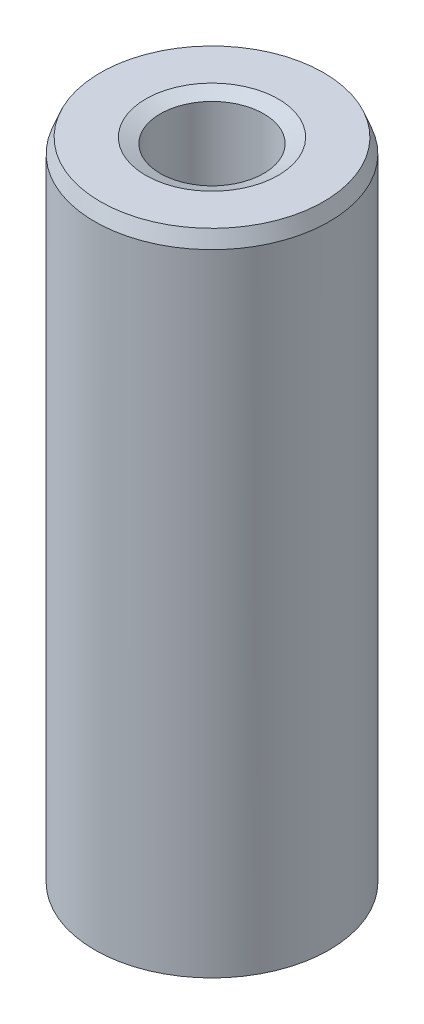
from build123d import *
from OCP.BRepFilletAPI import BRepFilletAPI_MakeChamfer

# Parameters (mm, degrees)
SKETCH1_R           = 10
BOSS_EXTRUDE1_DEPTH = 55.487522097
SKETCH2_R           = 4.410449867
CUT_EXTRUDE1_DEPTH  = 58.261375363
CHAMFER1_SIZE       = 1.237587935
CHAMFER1_SIZE2      = 0.478369418


with BuildPart() as part:
    # Sketch1 → Boss-Extrude1 (new body)
    with BuildSketch(Plane(origin=(0, 0, 0), x_dir=(1, 0, 0), z_dir=(0, 1, 0))):
        Circle(SKETCH1_R)
    extrude(amount=BOSS_EXTRUDE1_DEPTH)

    # Sketch2 → Cut-Extrude1 (cut, through all)
    with BuildSketch(Plane(origin=(0, 0, 0), x_dir=(1, 0, 0), z_dir=(0, 1, 0))):
        Circle(SKETCH2_R)
    extrude(amount=CUT_EXTRUDE1_DEPTH, mode=Mode.SUBTRACT)

    # Chamfer1: one chamfer whose edges measure the first distance from different faces: ONE call of the kernel's chamfer builder (chamfer() names one face for all edges)
    chamfer1_edges_1 = [part.edges().sort_by_distance(p)[0] for p in [
        (-4.410449867, 55.487522097, 0),
    ]]
    chamfer1_side_1 = [part.faces().sort_by_distance(p)[0] for p in [
        (-9.717157288, 55.487522097, 0),
    ]]
    chamfer1_edges_2 = [part.edges().sort_by_distance(p)[0] for p in [
        (-4.410449867, 0, 0),
    ]]
    chamfer1_side_2 = [part.faces().sort_by_distance(p)[0] for p in [
        (-4.410449867, 27.743761048, 0),
    ]]
    chamfer1_edges_3 = [part.edges().sort_by_distance(p)[0] for p in [
        (-10, 0, 0),
    ]]
    chamfer1_side_3 = [part.faces().sort_by_distance(p)[0] for p in [
        (-9.717157288, 0, 0),
    ]]
    chamfer1_edges_4 = [part.edges().sort_by_distance(p)[0] for p in [
        (-10, 55.487522097, 0),
    ]]
    chamfer1_side_4 = [part.faces().sort_by_distance(p)[0] for p in [
        (-10, 27.743761048, 0),
    ]]
    chamfer1 = BRepFilletAPI_MakeChamfer(part.part.solid().wrapped)
    for e in chamfer1_edges_1:
        chamfer1.Add(CHAMFER1_SIZE, CHAMFER1_SIZE2, e.wrapped, chamfer1_side_1[0].wrapped)  # the first distance lies on this face
    for e in chamfer1_edges_2:
        chamfer1.Add(CHAMFER1_SIZE, CHAMFER1_SIZE2, e.wrapped, chamfer1_side_2[0].wrapped)  # the first distance lies on this face
    for e in chamfer1_edges_3:
        chamfer1.Add(CHAMFER1_SIZE, CHAMFER1_SIZE2, e.wrapped, chamfer1_side_3[0].wrapped)  # the first distance lies on this face
    for e in chamfer1_edges_4:
        chamfer1.Add(CHAMFER1_SIZE, CHAMFER1_SIZE2, e.wrapped, chamfer1_side_4[0].wrapped)  # the first distance lies on this face
    add(Compound.cast(chamfer1.Shape()), mode=Mode.REPLACE)


solid = part.part
